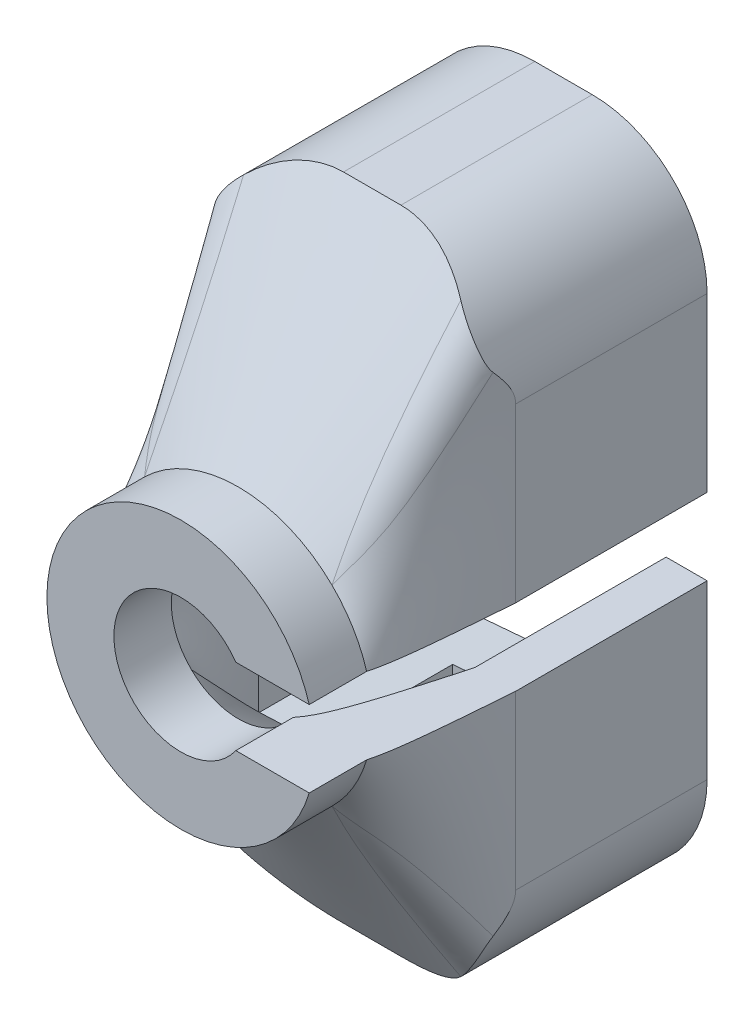
from build123d import *

# Parameters (mm, degrees)
ESBO_O1_5_W              = 15
ESBO_O1_5_H              = 34
ESBO_O1_5_R              = 1.75
RESSALTO_EXTRUS_O2_DEPTH = 10
FILETE1_R                = 6
FILETE5_R                = 2
RESSALTO_EXTRUS_O3_DEPTH = 3
ESBO_O5_W                = 8.424778789
ESBO_O5_H                = 4
CORTE_EXTRUS_O3_DEPTH    = 28.299267552
CORTE_EXTRUS_O4_START    = -3
ESBO_O6_W                = 5.6
ESBO_O6_H                = 32.066323014
CORTE_EXTRUS_O4_DEPTH    = 3


with BuildPart() as part:
    # Loft1: read off the stored shape, not the designer's step
    # Loft1: loft between two sections, ruled curve by curve
    loft1_from = [
        Edge.make_bspline([(-7.5, -17, 0), (-6.875, -17, 0), (-6.25, -17, 0), (-5, -17, 0), (-4.375, -17, 0), (-3.125, -17, 0), (-2.5, -17, 0), (-1.25, -17, 0), (-0.625, -17, 0), (0.625, -17, 0), (1.25, -17, 0), (2.5, -17, 0), (3.125, -17, 0), (4.375, -17, 0), (5, -17, 0), (6.25, -17, 0), (6.875, -17, 0), (7.5, -17, 0)], [0, 0, 0, 0, 0.125, 0.125, 0.25, 0.25, 0.375, 0.375, 0.5, 0.5, 0.625, 0.625, 0.75, 0.75, 0.875, 0.875, 1, 1, 1, 1], 3),
        Edge.make_bspline([(7.5, -17, 0), (7.5, -15.583333333, 0), (7.5, -14.166666667, 0), (7.5, -11.333333333, 0), (7.5, -9.916666667, 0), (7.5, -7.083333333, 0), (7.5, -5.666666667, 0), (7.5, -2.833333333, 0), (7.5, -1.416666667, 0), (7.5, 1.416666667, 0), (7.5, 2.833333333, 0), (7.5, 5.666666667, 0), (7.5, 7.083333333, 0), (7.5, 9.916666667, 0), (7.5, 11.333333333, 0), (7.5, 14.166666667, 0), (7.5, 15.583333333, 0), (7.5, 17, 0)], [0, 0, 0, 0, 0.125, 0.125, 0.25, 0.25, 0.375, 0.375, 0.5, 0.5, 0.625, 0.625, 0.75, 0.75, 0.875, 0.875, 1, 1, 1, 1], 3),
        Edge.make_bspline([(-7.5, 17, 0), (-7.5, 15.583333333, 0), (-7.5, 14.166666667, 0), (-7.5, 11.333333333, 0), (-7.5, 9.916666667, 0), (-7.5, 7.083333333, 0), (-7.5, 5.666666667, 0), (-7.5, 2.833333333, 0), (-7.5, 1.416666667, 0), (-7.5, -1.416666667, 0), (-7.5, -2.833333333, 0), (-7.5, -5.666666667, 0), (-7.5, -7.083333333, 0), (-7.5, -9.916666667, 0), (-7.5, -11.333333333, 0), (-7.5, -14.166666667, 0), (-7.5, -15.583333333, 0), (-7.5, -17, 0)], [0, 0, 0, 0, 0.125, 0.125, 0.25, 0.25, 0.375, 0.375, 0.5, 0.5, 0.625, 0.625, 0.75, 0.75, 0.875, 0.875, 1, 1, 1, 1], 3),
        Edge.make_bspline([(7.5, 17, 0), (6.875, 17, 0), (6.25, 17, 0), (5, 17, 0), (4.375, 17, 0), (3.125, 17, 0), (2.5, 17, 0), (1.25, 17, 0), (0.625, 17, 0), (-0.625, 17, 0), (-1.25, 17, 0), (-2.5, 17, 0), (-3.125, 17, 0), (-4.375, 17, 0), (-5, 17, 0), (-6.25, 17, 0), (-6.875, 17, 0), (-7.5, 17, 0)], [0, 0, 0, 0, 0.125, 0.125, 0.25, 0.25, 0.375, 0.375, 0.5, 0.5, 0.625, 0.625, 0.75, 0.75, 0.875, 0.875, 1, 1, 1, 1], 3),
    ]
    loft1_to = [
        Edge.make_bspline([(-4.897277334, -5.001667193, 7), (-4.605675532, -5.28718297, 7), (-4.27833882, -5.557453892, 7), (-3.556869488, -6.044679997, 7), (-3.162705953, -6.261483105, 7), (-2.321696048, -6.619562454, 7), (-1.874914628, -6.760671722, 7), (-0.952015093, -6.950946285, 7), (-0.476058045, -7, 7), (0.476058045, -7, 7), (0.952015093, -6.950946285, 7), (1.874914628, -6.760671722, 7), (2.321696048, -6.619562454, 7), (3.162705953, -6.261483105, 7), (3.556869488, -6.044679997, 7), (4.27833882, -5.557453892, 7), (4.605675532, -5.28718297, 7), (4.897277334, -5.001667193, 7)], [0, 0, 0, 0, 0.125, 0.125, 0.25, 0.25, 0.375, 0.375, 0.5, 0.5, 0.625, 0.625, 0.75, 0.75, 0.875, 0.875, 1, 1, 1, 1], 3),
        Edge.make_bspline([(4.897277334, -5.001667193, 7), (5.19509489, -4.710065391, 7), (5.478144605, -4.380519937, 7), (5.98991862, -3.649643566, 7), (6.218471239, -3.24826874, 7), (6.596701552, -2.388338959, 7), (6.746184539, -1.92985203, 7), (6.94789999, -0.9808264, 7), (7, -0.490471746, 7), (7, 0.490471746, 7), (6.94789999, 0.9808264, 7), (6.746184539, 1.92985203, 7), (6.596701552, 2.388338959, 7), (6.218471239, 3.24826874, 7), (5.98991862, 3.649643566, 7), (5.478144605, 4.380519937, 7), (5.19509489, 4.710065391, 7), (4.897277334, 5.001667193, 7)], [0, 0, 0, 0, 0.125, 0.125, 0.25, 0.25, 0.375, 0.375, 0.5, 0.5, 0.625, 0.625, 0.75, 0.75, 0.875, 0.875, 1, 1, 1, 1], 3),
        Edge.make_bspline([(-4.897277334, 5.001667193, 7), (-5.19509489, 4.710065391, 7), (-5.478144605, 4.380519937, 7), (-5.98991862, 3.649643566, 7), (-6.218471239, 3.24826874, 7), (-6.596701552, 2.388338959, 7), (-6.746184539, 1.92985203, 7), (-6.94789999, 0.9808264, 7), (-7, 0.490471746, 7), (-7, -0.490471746, 7), (-6.94789999, -0.9808264, 7), (-6.746184539, -1.92985203, 7), (-6.596701552, -2.388338959, 7), (-6.218471239, -3.24826874, 7), (-5.98991862, -3.649643566, 7), (-5.478144605, -4.380519937, 7), (-5.19509489, -4.710065391, 7), (-4.897277334, -5.001667193, 7)], [0, 0, 0, 0, 0.125, 0.125, 0.25, 0.25, 0.375, 0.375, 0.5, 0.5, 0.625, 0.625, 0.75, 0.75, 0.875, 0.875, 1, 1, 1, 1], 3),
        Edge.make_bspline([(4.897277334, 5.001667193, 7), (4.605675532, 5.28718297, 7), (4.27833882, 5.557453892, 7), (3.556869488, 6.044679997, 7), (3.162705953, 6.261483105, 7), (2.321696048, 6.619562454, 7), (1.874914628, 6.760671722, 7), (0.952015093, 6.950946285, 7), (0.476058045, 7, 7), (-0.476058045, 7, 7), (-0.952015093, 6.950946285, 7), (-1.874914628, 6.760671722, 7), (-2.321696048, 6.619562454, 7), (-3.162705953, 6.261483105, 7), (-3.556869488, 6.044679997, 7), (-4.27833882, 5.557453892, 7), (-4.605675532, 5.28718297, 7), (-4.897277334, 5.001667193, 7)], [0, 0, 0, 0, 0.125, 0.125, 0.25, 0.25, 0.375, 0.375, 0.5, 0.5, 0.625, 0.625, 0.75, 0.75, 0.875, 0.875, 1, 1, 1, 1], 3),
    ]
    loft1 = Solid(Shell([*[Face.make_surface_from_curves(loft1_from[k], loft1_to[k]) for k in range(4)], Face(Wire(loft1_from)), Face(Wire(loft1_to))]))
    add(loft1)

    # Esboço1<5> → Ressalto-extrusão2 (add)
    with BuildSketch(Plane.XY):
        Rectangle(ESBO_O1_5_W, ESBO_O1_5_H)
        with Locations((0, -12.5)):
            Circle(ESBO_O1_5_R, mode=Mode.SUBTRACT)
        with Locations((0, 12.5)):
            Circle(ESBO_O1_5_R, mode=Mode.SUBTRACT)
        Polygon((-5.940921409, 9.7), (5.359078591, 8.75), (5.359078591, -8.75), (-5.940921409, -9.7), align=None, mode=Mode.SUBTRACT)
    extrude(amount=-RESSALTO_EXTRUS_O2_DEPTH)

    # Filete1
    filete1_edges = [part.edges().sort_by_distance(p)[0] for p in [
        (-7.5, -17, -5),
        (-7.5, 17, -5),
        (7.5, -17, -5),
        (7.5, 17, -5),
    ]]
    fillet(filete1_edges, radius=FILETE1_R)

    # Filete5
    filete5_edges = [part.edges().sort_by_distance(p)[0] for p in [
        (5.851670791, 9.401340843, 4.433167087),
        (-5.851670791, 9.401340843, 4.433167087),
        (5.851670791, -9.401340843, 4.433167087),
        (-5.851670791, -9.401340843, 4.433167087),
    ]]
    fillet(filete5_edges, radius=FILETE5_R)

    # Esboço3<9> → Ressalto-extrusão3 (add)
    with BuildSketch(Plane.XY.offset(7)):
        with BuildLine():
            ThreePointArc((4.897277334, 5.001667193), (7, 0), (4.897277334, -5.001667193))
            ThreePointArc((4.897277334, -5.001667193), (0, -7), (-4.897277334, -5.001667193))
            ThreePointArc((-4.897277334, -5.001667193), (-7, 0), (-4.897277334, 5.001667193))
            ThreePointArc((-4.897277334, 5.001667193), (0, 7), (4.897277334, 5.001667193))
        make_face()
        with BuildLine():
            ThreePointArc((2.448638667, 2.500833597), (3.5, 0), (2.448638667, -2.500833597))
            ThreePointArc((2.448638667, -2.500833597), (0, -3.5), (-2.448638667, -2.500833597))
            ThreePointArc((-2.448638667, -2.500833597), (-3.5, 0), (-2.448638667, 2.500833597))
            ThreePointArc((-2.448638667, 2.500833597), (0, 3.5), (2.448638667, 2.500833597))
        make_face(mode=Mode.SUBTRACT)
    extrude(amount=RESSALTO_EXTRUS_O3_DEPTH)

    # Loft de corte1: read off the stored shape, not the designer's step
    # Loft de corte1: loft between two sections, ruled curve by curve
    loft_de_corte1_from = [
        Edge.make_bspline([(2.448638667, 2.500833597, 7), (2.746456223, 2.209231794, 7), (3.014678041, 1.839116815, 7), (3.392908354, 0.979187034, 7), (3.5, 0.490471746, 7), (3.5, -0.490471746, 7), (3.392908354, -0.979187034, 7), (3.014678041, -1.839116815, 7), (2.746456223, -2.209231794, 7), (2.448638667, -2.500833597, 7)], [0, 0, 0, 0, 0.25, 0.25, 0.5, 0.5, 0.75, 0.75, 1, 1, 1, 1], 3),
        Edge.make_bspline([(2.448638667, -2.500833597, 7), (2.157036865, -2.786349374, 7), (1.791605453, -3.041221715, 7), (0.950595548, -3.399301064, 7), (0.476058045, -3.5, 7), (-0.476058045, -3.5, 7), (-0.950595548, -3.399301064, 7), (-1.791605453, -3.041221715, 7), (-2.157036865, -2.786349374, 7), (-2.448638667, -2.500833597, 7)], [0, 0, 0, 0, 0.25, 0.25, 0.5, 0.5, 0.75, 0.75, 1, 1, 1, 1], 3),
        Edge.make_bspline([(-2.448638667, 2.500833597, 7), (-2.157036865, 2.786349374, 7), (-1.791605453, 3.041221715, 7), (-0.950595548, 3.399301064, 7), (-0.476058045, 3.5, 7), (0.476058045, 3.5, 7), (0.950595548, 3.399301064, 7), (1.791605453, 3.041221715, 7), (2.157036865, 2.786349374, 7), (2.448638667, 2.500833597, 7)], [0, 0, 0, 0, 0.25, 0.25, 0.5, 0.5, 0.75, 0.75, 1, 1, 1, 1], 3),
        Edge.make_bspline([(-2.448638667, -2.500833597, 7), (-2.746456223, -2.209231794, 7), (-3.014678041, -1.839116815, 7), (-3.392908354, -0.979187034, 7), (-3.5, -0.490471746, 7), (-3.5, 0.490471746, 7), (-3.392908354, 0.979187034, 7), (-3.014678041, 1.839116815, 7), (-2.746456223, 2.209231794, 7), (-2.448638667, 2.500833597, 7)], [0, 0, 0, 0, 0.25, 0.25, 0.5, 0.5, 0.75, 0.75, 1, 1, 1, 1], 3),
    ]
    loft_de_corte1_to = [
        Edge.make_bspline([(5.359078591, 8.75, 0), (5.359078591, 7.291666667, 0), (5.359078591, 5.833333333, 0), (5.359078591, 2.916666667, 0), (5.359078591, 1.458333333, 0), (5.359078591, -1.458333333, 0), (5.359078591, -2.916666667, 0), (5.359078591, -5.833333333, 0), (5.359078591, -7.291666667, 0), (5.359078591, -8.75, 0)], [0, 0, 0, 0, 0.25, 0.25, 0.5, 0.5, 0.75, 0.75, 1, 1, 1, 1], 3),
        Edge.make_bspline([(5.359078591, -8.75, 0), (4.417411924, -8.829166667, 0), (3.475745257, -8.908333333, 0), (1.592411924, -9.066666667, 0), (0.650745257, -9.145833333, 0), (-1.232588076, -9.304166667, 0), (-2.174254743, -9.383333333, 0), (-4.057588076, -9.541666667, 0), (-4.999254743, -9.620833333, 0), (-5.940921409, -9.7, 0)], [0, 0, 0, 0, 0.25, 0.25, 0.5, 0.5, 0.75, 0.75, 1, 1, 1, 1], 3),
        Edge.make_bspline([(-5.940921409, 9.7, 0), (-4.999254743, 9.620833333, 0), (-4.057588076, 9.541666667, 0), (-2.174254743, 9.383333333, 0), (-1.232588076, 9.304166667, 0), (0.650745257, 9.145833333, 0), (1.592411924, 9.066666667, 0), (3.475745257, 8.908333333, 0), (4.417411924, 8.829166667, 0), (5.359078591, 8.75, 0)], [0, 0, 0, 0, 0.25, 0.25, 0.5, 0.5, 0.75, 0.75, 1, 1, 1, 1], 3),
        Edge.make_bspline([(-5.940921409, -9.7, 0), (-5.940921409, -8.083333333, 0), (-5.940921409, -6.466666667, 0), (-5.940921409, -3.233333333, 0), (-5.940921409, -1.616666667, 0), (-5.940921409, 1.616666667, 0), (-5.940921409, 3.233333333, 0), (-5.940921409, 6.466666667, 0), (-5.940921409, 8.083333333, 0), (-5.940921409, 9.7, 0)], [0, 0, 0, 0, 0.25, 0.25, 0.5, 0.5, 0.75, 0.75, 1, 1, 1, 1], 3),
    ]
    loft_de_corte1 = Solid(Shell([*[Face.make_surface_from_curves(loft_de_corte1_from[k], loft_de_corte1_to[k]) for k in range(4)], Face(Wire(loft_de_corte1_from)), Face(Wire(loft_de_corte1_to))]))
    add(loft_de_corte1, mode=Mode.SUBTRACT)

    # Esboço5 → Corte-extrusão3 (cut, through all)
    with BuildSketch(Plane.XY.offset(10)):
        with Locations((7.084670717, 0)):
            Rectangle(ESBO_O5_W, ESBO_O5_H)
    extrude(amount=-CORTE_EXTRUS_O3_DEPTH, mode=Mode.SUBTRACT)

    # Esboço6 → Corte-extrusão4 (cut)
    with BuildSketch(Plane(origin=(0, 0, -10), x_dir=(-1, 0, 0), z_dir=(0, 0, -1)).offset(CORTE_EXTRUS_O4_START)):
        Rectangle(ESBO_O6_W, ESBO_O6_H)
    extrude(amount=-CORTE_EXTRUS_O4_DEPTH, mode=Mode.SUBTRACT)


solid = part.part
